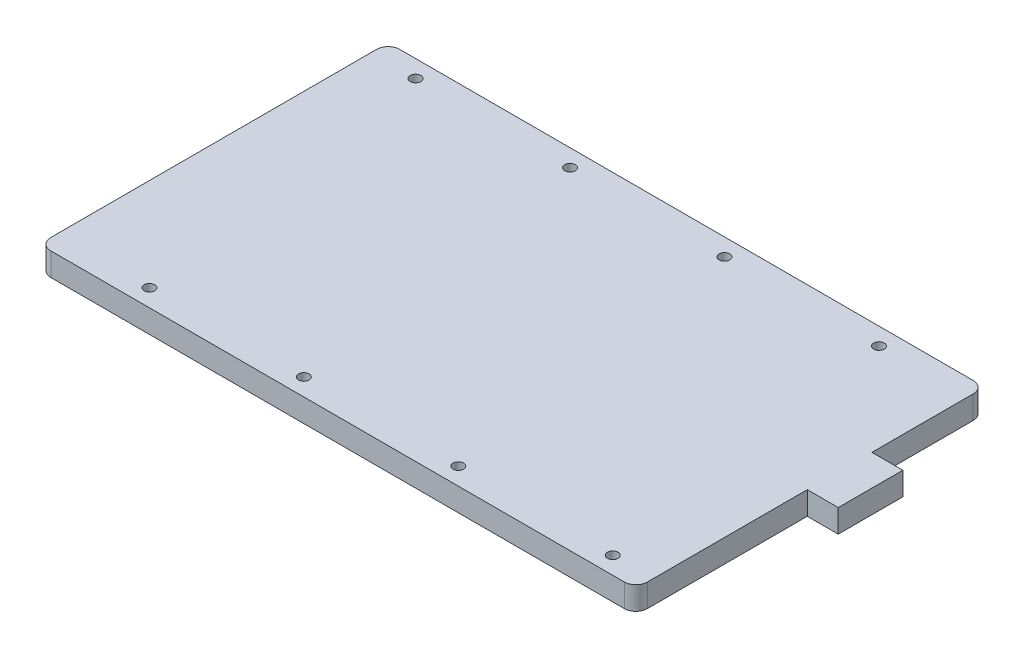
from build123d import *

# Parameters (mm, degrees)
BOSS_EXTRUDE1_DEPTH            = 12
CBORE_FOR_M5_SHCS1_D           = 5.5
CBORE_FOR_M5_SHCS1_DEPTH       = 12
CBORE_FOR_M5_SHCS1_CBORE_D     = 10
CBORE_FOR_M5_SHCS1_CBORE_DEPTH = 6
CBORE_FOR_M5_SHCS1_TIP         = 1.652366702
FILLET1_R                      = 6


with BuildPart() as part:
    # Sketch1 → Boss-Extrude1 (new body)
    with BuildSketch(Plane(origin=(0, 0, 0), x_dir=(1, 0, 0), z_dir=(0, 1, 0))):
        Polygon((155, 90.65), (-155, 90.65), (-155, -90.65), (155, -90.65), (155, -1.585790321), (171.07879109, -1.585790321), (171.07879109, 31.995651769), (155, 31.995651769), align=None)
    extrude(amount=BOSS_EXTRUDE1_DEPTH)

    # CBORE for M5 SHCS1
    with Locations(Plane.XZ):
        with Locations((-131.75, -81.65), (-106.75, 81.65), (-26.5, 81.65), (53.75, 81.65), (134, 81.65), (-51.5, -81.65), (109, -81.65), (28.75, -81.65)):
            CounterBoreHole(CBORE_FOR_M5_SHCS1_D / 2, CBORE_FOR_M5_SHCS1_CBORE_D / 2, CBORE_FOR_M5_SHCS1_CBORE_DEPTH, depth=CBORE_FOR_M5_SHCS1_DEPTH)
            with Locations((0, 0, -(CBORE_FOR_M5_SHCS1_DEPTH + CBORE_FOR_M5_SHCS1_TIP / 2))):  # 118° drill point
                Cone(0, CBORE_FOR_M5_SHCS1_D / 2, CBORE_FOR_M5_SHCS1_TIP, mode=Mode.SUBTRACT)

    # Fillet1
    fillet1_edges = [part.edges().sort_by_distance(p)[0] for p in [
        (155, 6, 90.65),
        (155, 6, -90.65),
        (-155, 6, 90.65),
        (-155, 6, -90.65),
    ]]
    fillet(fillet1_edges, radius=FILLET1_R)


solid = part.part
